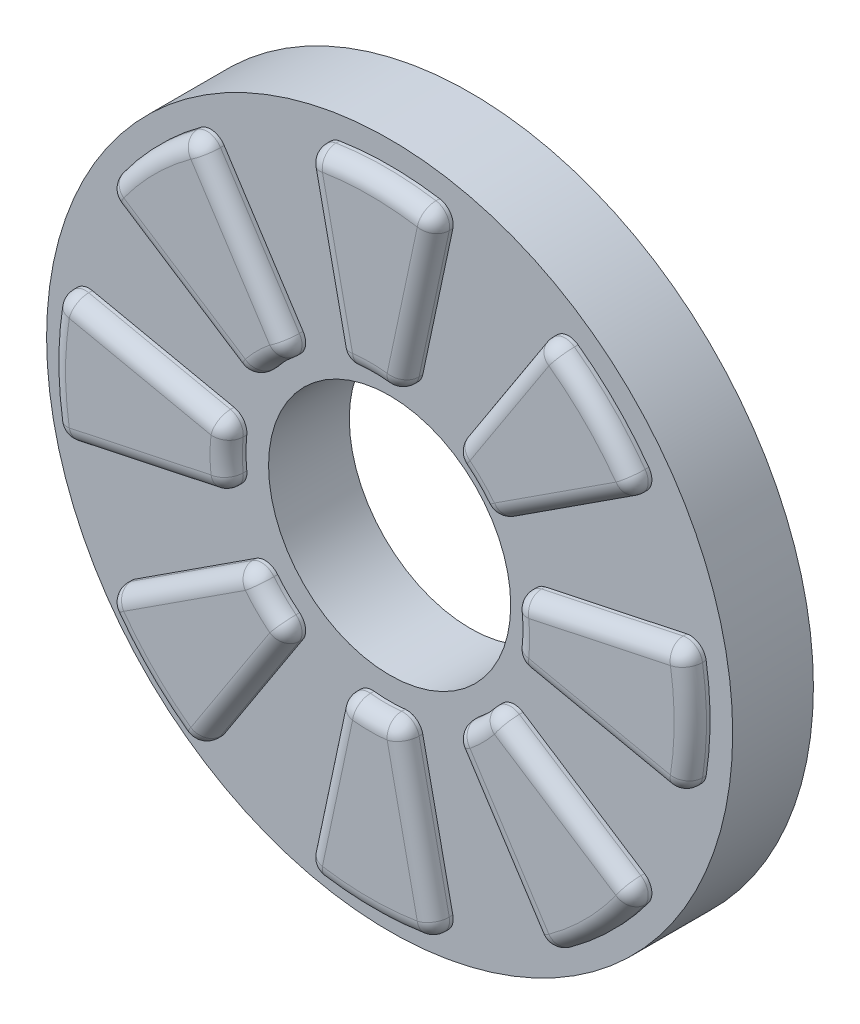
from build123d import *

# Parameters (mm, degrees)
SKETCH1_R           = 26.9875
SKETCH1_R_2         = 9.525
BOSS_EXTRUDE1_DEPTH = 6.35
BOSS_EXTRUDE2_DEPTH = 1.55575
FILLET1_R           = 1.27
FILLET2_R           = 1.27


with BuildPart() as part:
    # Sketch1 → Boss-Extrude1 (new body)
    with BuildSketch(Plane.XY):
        Circle(SKETCH1_R)
        Circle(SKETCH1_R_2, mode=Mode.SUBTRACT)
    extrude(amount=BOSS_EXTRUDE1_DEPTH)

    # Sketch3 → Boss-Extrude2 (add)
    with BuildSketch(Plane.XY.offset(6.35)):
        with BuildLine():
            Line((-5.245254895, 24.657781557), (-2.351776754, 11.055630018))
            ThreePointArc((-2.351776754, 11.055630018), (0, 11.303), (2.351776754, 11.055630018))
            Line((2.351776754, 11.055630018), (5.245254895, 24.657781557))
            ThreePointArc((5.245254895, 24.657781557), (0, 25.2095), (-5.245254895, 24.657781557))
        make_face()
        with BuildLine():
            Line((9.480468247, 6.154553666), (21.144639854, 13.726729243))
            ThreePointArc((21.144639854, 13.726729243), (17.8258084, 17.8258084), (13.726729243, 21.144639854))
            Line((13.726729243, 21.144639854), (6.154553666, 9.480468247))
            ThreePointArc((6.154553666, 9.480468247), (7.992427948, 7.992427948), (9.480468247, 6.154553666))
        make_face()
        with BuildLine():
            Line((11.055630018, -2.351776754), (24.657781557, -5.245254895))
            ThreePointArc((24.657781557, -5.245254895), (25.2095, 0), (24.657781557, 5.245254895))
            Line((24.657781557, 5.245254895), (11.055630018, 2.351776754))
            ThreePointArc((11.055630018, 2.351776754), (11.303, 0), (11.055630018, -2.351776754))
        make_face()
        with BuildLine():
            Line((6.154553666, -9.480468247), (13.726729243, -21.144639854))
            ThreePointArc((13.726729243, -21.144639854), (17.8258084, -17.8258084), (21.144639854, -13.726729243))
            Line((21.144639854, -13.726729243), (9.480468247, -6.154553666))
            ThreePointArc((9.480468247, -6.154553666), (7.992427948, -7.992427948), (6.154553666, -9.480468247))
        make_face()
        with BuildLine():
            Line((-2.351776754, -11.055630018), (-5.245254895, -24.657781557))
            ThreePointArc((-5.245254895, -24.657781557), (0, -25.2095), (5.245254895, -24.657781557))
            Line((5.245254895, -24.657781557), (2.351776754, -11.055630018))
            ThreePointArc((2.351776754, -11.055630018), (0, -11.303), (-2.351776754, -11.055630018))
        make_face()
        with BuildLine():
            Line((-9.480468247, -6.154553666), (-21.144639854, -13.726729243))
            ThreePointArc((-21.144639854, -13.726729243), (-17.8258084, -17.8258084), (-13.726729243, -21.144639854))
            Line((-13.726729243, -21.144639854), (-6.154553666, -9.480468247))
            ThreePointArc((-6.154553666, -9.480468247), (-7.992427948, -7.992427948), (-9.480468247, -6.154553666))
        make_face()
        with BuildLine():
            Line((-11.055630018, 2.351776754), (-24.657781557, 5.245254895))
            ThreePointArc((-24.657781557, 5.245254895), (-25.2095, 0), (-24.657781557, -5.245254895))
            Line((-24.657781557, -5.245254895), (-11.055630018, -2.351776754))
            ThreePointArc((-11.055630018, -2.351776754), (-11.303, 0), (-11.055630018, 2.351776754))
        make_face()
        with BuildLine():
            Line((-6.154553666, 9.480468247), (-13.726729243, 21.144639854))
            ThreePointArc((-13.726729243, 21.144639854), (-17.8258084, 17.8258084), (-21.144639854, 13.726729243))
            Line((-21.144639854, 13.726729243), (-9.480468247, 6.154553666))
            ThreePointArc((-9.480468247, 6.154553666), (-7.992427948, 7.992427948), (-6.154553666, 9.480468247))
        make_face()
    extrude(amount=BOSS_EXTRUDE2_DEPTH)

    # Fillet1
    fillet1_edges = [part.edges().sort_by_distance(p)[0] for p in [
        (-24.657781557, 5.245254895, 7.127875),
        (21.144639854, -13.726729243, 7.127875),
        (24.657781557, 5.245254895, 7.127875),
        (9.480468247, -6.154553666, 7.127875),
        (2.351776754, -11.055630018, 7.127875),
        (-6.154553666, -9.480468247, 7.127875),
        (-9.480468247, -6.154553666, 7.127875),
        (-11.055630018, 2.351776754, 7.127875),
        (11.055630018, -2.351776754, 7.127875),
        (24.657781557, -5.245254895, 7.127875),
        (5.245254895, -24.657781557, 7.127875),
        (-24.657781557, -5.245254895, 7.127875),
        (-11.055630018, -2.351776754, 7.127875),
        (-21.144639854, -13.726729243, 7.127875),
        (-13.726729243, -21.144639854, 7.127875),
        (-2.351776754, -11.055630018, 7.127875),
        (-5.245254895, -24.657781557, 7.127875),
        (13.726729243, -21.144639854, 7.127875),
        (6.154553666, -9.480468247, 7.127875),
        (9.480468247, 6.154553666, 7.127875),
        (11.055630018, 2.351776754, 7.127875),
        (6.154553666, 9.480468247, 7.127875),
        (21.144639854, 13.726729243, 7.127875),
        (13.726729243, 21.144639854, 7.127875),
        (-5.245254895, 24.657781557, 7.127875),
        (5.245254895, 24.657781557, 7.127875),
        (2.351776754, 11.055630018, 7.127875),
        (-2.351776754, 11.055630018, 7.127875),
        (-9.480468247, 6.154553666, 7.127875),
        (-6.154553666, 9.480468247, 7.127875),
        (-13.726729243, 21.144639854, 7.127875),
        (-21.144639854, 13.726729243, 7.127875),
    ]]
    fillet(fillet1_edges, radius=FILLET1_R)

    # Fillet2
    fillet2_edges = [part.edges().sort_by_distance(p)[0] for p in [
        (-4.778287459, -24.366392101, 7.90575),
        (-3.788318834, -17.80877005, 7.90575),
        (-2.104941883, -11.470293616, 7.90575),
        (0, -11.303, 7.90575),
        (2.104941883, -11.470293616, 7.90575),
        (3.788318834, -17.80877005, 7.90575),
        (4.778287459, -24.366392101, 7.90575),
        (0, -25.2095, 7.90575),
        (-13.850881624, -20.608400552, 7.90575),
        (-17.8258084, -17.8258084, 7.90575),
        (-20.608400552, -13.850881624, 7.90575),
        (-15.271448004, -9.91395613, 7.90575),
        (-9.599141078, -6.622303719, 7.90575),
        (-7.992427948, -7.992427948, 7.90575),
        (-6.622303719, -9.599141078, 7.90575),
        (13.850881624, -20.608400552, 7.90575),
        (9.91395613, -15.271448004, 7.90575),
        (6.622303719, -9.599141078, 7.90575),
        (7.992427948, -7.992427948, 7.90575),
        (9.599141078, -6.622303719, 7.90575),
        (15.271448004, -9.91395613, 7.90575),
        (20.608400552, -13.850881624, 7.90575),
        (17.8258084, -17.8258084, 7.90575),
        (24.366392101, -4.778287459, 7.90575),
        (17.80877005, -3.788318834, 7.90575),
        (11.470293616, -2.104941883, 7.90575),
        (11.303, 0, 7.90575),
        (11.470293616, 2.104941883, 7.90575),
        (17.80877005, 3.788318834, 7.90575),
        (24.366392101, 4.778287459, 7.90575),
        (25.2095, 0, 7.90575),
        (6.622303719, 9.599141078, 7.90575),
        (9.91395613, 15.271448004, 7.90575),
        (13.850881624, 20.608400552, 7.90575),
        (17.8258084, 17.8258084, 7.90575),
        (20.608400552, 13.850881624, 7.90575),
        (15.271448004, 9.91395613, 7.90575),
        (9.599141078, 6.622303719, 7.90575),
        (7.992427948, 7.992427948, 7.90575),
        (4.778287459, 24.366392101, 7.90575),
        (3.788318834, 17.80877005, 7.90575),
        (2.104941883, 11.470293616, 7.90575),
        (0, 11.303, 7.90575),
        (-2.104941883, 11.470293616, 7.90575),
        (-3.788318834, 17.80877005, 7.90575),
        (-4.778287459, 24.366392101, 7.90575),
        (0, 25.2095, 7.90575),
        (-20.608400552, 13.850881624, 7.90575),
        (-17.8258084, 17.8258084, 7.90575),
        (-13.850881624, 20.608400552, 7.90575),
        (-9.91395613, 15.271448004, 7.90575),
        (-6.622303719, 9.599141078, 7.90575),
        (-7.992427948, 7.992427948, 7.90575),
        (-9.599141078, 6.622303719, 7.90575),
        (-15.271448004, 9.91395613, 7.90575),
        (-11.470293616, 2.104941883, 7.90575),
        (-11.303, 0, 7.90575),
        (-11.470293616, -2.104941883, 7.90575),
        (-17.80877005, -3.788318834, 7.90575),
        (-24.366392101, -4.778287459, 7.90575),
        (-25.2095, 0, 7.90575),
        (-24.366392101, 4.778287459, 7.90575),
        (-17.80877005, 3.788318834, 7.90575),
        (-9.91395613, -15.271448004, 7.90575),
    ]]
    fillet(fillet2_edges, radius=FILLET2_R)


solid = part.part
